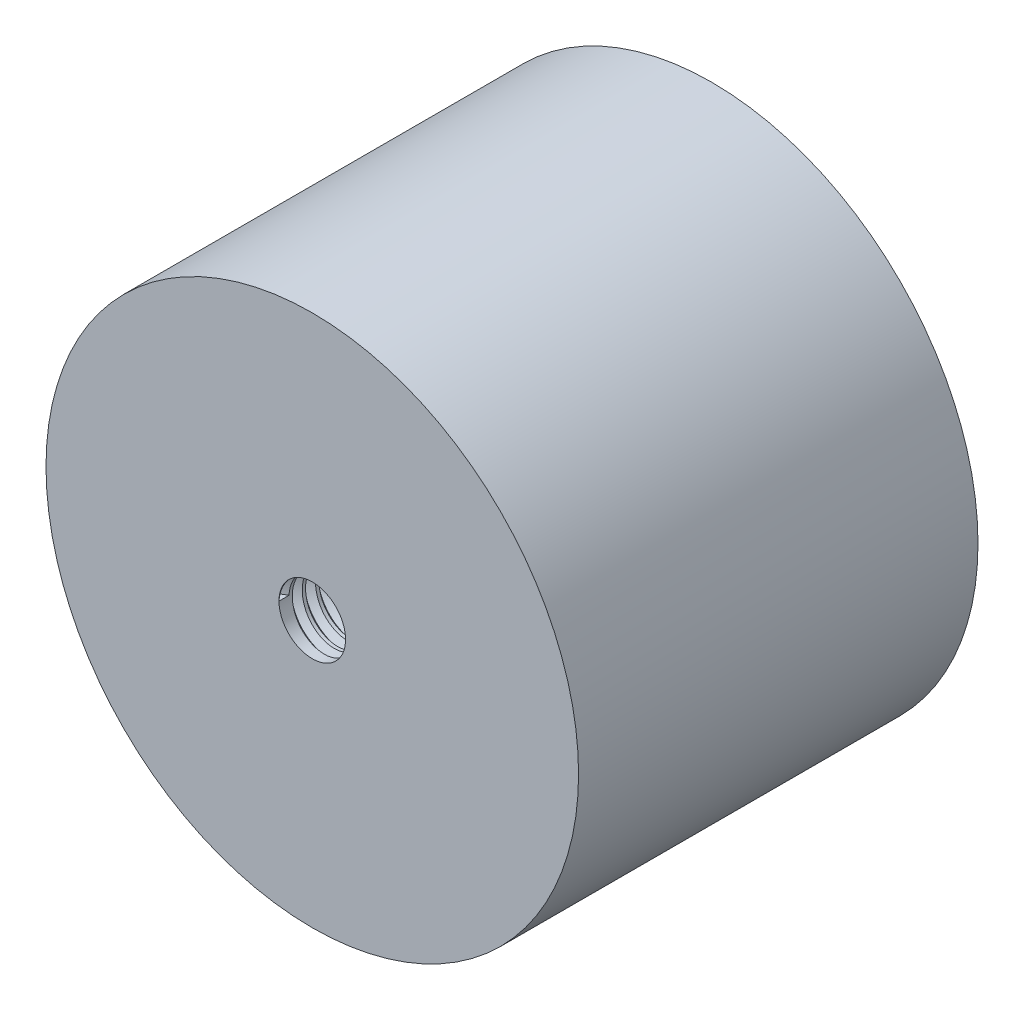
from build123d import *

# Parameters (mm, degrees)
SKETCH1_R                   = 10
BOSS_EXTRUDE1_DEPTH         = 15
TAP_DRILL_FOR_M3_TAP1_D     = 2.5
TAP_DRILL_FOR_M3_TAP1_DEPTH = 10
TAP_DRILL_FOR_M3_TAP1_TIP   = 0.751075774
THREAD1_PITCH               = 0.5


with BuildPart() as part:
    # Sketch1 → Boss-Extrude1 (new body)
    with BuildSketch(Plane.XY):
        Circle(SKETCH1_R)
    extrude(amount=BOSS_EXTRUDE1_DEPTH)

    # Tap Drill for M3 Tap1
    with Locations(Plane.XY.offset(15)):
        with Locations((0, 0)):
            Hole(TAP_DRILL_FOR_M3_TAP1_D / 2, depth=TAP_DRILL_FOR_M3_TAP1_DEPTH)
            with Locations((0, 0, -(TAP_DRILL_FOR_M3_TAP1_DEPTH + TAP_DRILL_FOR_M3_TAP1_TIP / 2))):  # 118° drill point
                Cone(0, TAP_DRILL_FOR_M3_TAP1_D / 2, TAP_DRILL_FOR_M3_TAP1_TIP, mode=Mode.SUBTRACT)

    # Thread1: the profile of Thread Profile1 profile screwed along a right-hand helix of 20 turns, 6 arcs to a turn; built about Z, then put on its axis
    thread1_z = Axis((0, 0, 0), (0, 0, 1))
    thread1_corners = [(1.2497, 0, -0.000173205), (1.520632937, 0, 0.156249999), (1.520632937, 0, 0.218749999), (1.2497, 0, 0.375173204)]
    with BuildLine(mode=Mode.PRIVATE) as thread1_profile:
        Line(thread1_corners[0], thread1_corners[1])
        Line(thread1_corners[1], thread1_corners[2])
        Line(thread1_corners[2], thread1_corners[3])
        Line(thread1_corners[3], thread1_corners[0])
    thread1_cap = Face(thread1_profile.wire())
    thread1_turn_angles = [0, 30, 60, 90, 120, 150, 180, 210, 240, 270, 300, 330, 360]
    thread1_turn_weights = [1, 0.8660254037844387, 1, 0.8660254037844387, 1, 0.8660254037844387, 1, 0.8660254037844387, 1, 0.8660254037844387, 1, 0.8660254037844387, 1]
    thread1_turn_rails = [Edge.make_bspline([Vector(p[0], p[1], 0).rotate(thread1_z, thread1_turn_angles[k]) / thread1_turn_weights[k] + Vector(0, 0, p[2] + THREAD1_PITCH * thread1_turn_angles[k] / 360) for k in range(13)], [0, 0, 0, 1, 1, 2, 2, 3, 3, 4, 4, 5, 5, 6, 6, 6], 2, thread1_turn_weights) for p in thread1_corners]
    thread1_turn_sides = [Face.make_surface_from_curves(thread1_turn_rails[p[0]], thread1_turn_rails[p[1]]) for p in [(0, 1), (1, 2), (2, 3), (3, 0)]]
    thread1 = Plane(origin=(0, 0, 15), x_dir=(-1, 0, 0), z_dir=(0, 0, -1)) * Solid(Shell([*[p.moved(Location((0, 0, THREAD1_PITCH * i))) for i in range(20) for p in thread1_turn_sides], thread1_cap, thread1_cap.rotate(thread1_z, 7200).moved(Location((0, 0, THREAD1_PITCH * 7200 / 360)))]))
    add(thread1, mode=Mode.SUBTRACT)


solid = part.part
